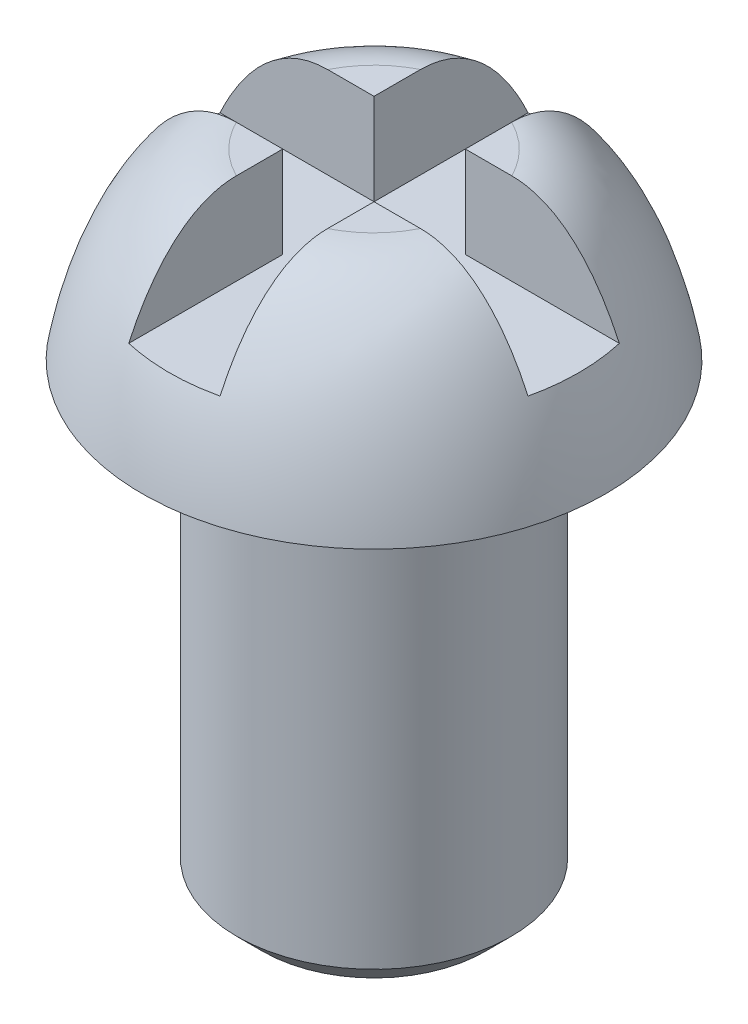
from build123d import *

# Parameters (mm, degrees)
SKETCH1_R           = 2.625
BOSS_EXTRUDE1_DEPTH = 2
SKETCH2_R           = 1.5
BOSS_EXTRUDE2_DEPTH = 5
FILLET1_SIZE        = 3
FILLET1_SIZE_2      = 1.5
SKETCH4_W           = 1
SKETCH4_H           = 1
CUT_EXTRUDE1_DEPTH  = 1


# Read off the part's stored shape, not the designer's step: M3x0.5 Machine Threads Stud1
with BuildPart() as part:
    # Sketch1 → Boss-Extrude1 (new body)
    with BuildSketch(Plane(origin=(0, 0, 0), x_dir=(1, 0, 0), z_dir=(0, 1, 0))):
        with Locations(Location((0, 0, 0), (0, 0, 270))):
            Circle(SKETCH1_R)
    extrude(amount=-BOSS_EXTRUDE1_DEPTH)

    # Sketch2 → Boss-Extrude2 (add)
    with BuildSketch(Plane(origin=(0, -2, 0), x_dir=(-1, 0, 0), z_dir=(0, -1, 0))):
        with Locations(Location((0, 0, 0), (0, 0, 90))):
            Circle(SKETCH2_R)
    extrude(amount=BOSS_EXTRUDE2_DEPTH)

    # M3x0.5 Machine Threads Stud1 outline → M3x0.5 Machine Threads Stud1 (revolve, cut)
    with BuildSketch(Plane.XY):
        Polygon((1.5, -6.7195), (1.2195, -7), (1.5, -7), align=None)
    revolve(axis=Axis((0, 0, 0), (0, 1, 0)), mode=Mode.SUBTRACT)

    # Fillet1
    # an asymmetric fillet: 3, 1.5 mm, written as the material it takes off along each edge
    with BuildSketch(Plane(origin=(0, 0, 0), x_dir=(0, 0, 1), z_dir=(-1, 0, 0))) as fillet1_piece_1:
        with BuildLine():
            Bezier((2.625, -FILLET1_SIZE), (2.625, 0), (2.625 - FILLET1_SIZE_2, 0), weights=[1, 0.707106781, 1])
            Line((2.625 - FILLET1_SIZE_2, 0), (2.625, 0))
            Line((2.625, 0), (2.625, -FILLET1_SIZE))
        make_face()
    revolve(axis=Axis((0, 0, 0), (0, 1, 0)), mode=Mode.SUBTRACT)

    # Sketch4 → Cut-Extrude1 (cut)
    with BuildSketch(Plane(origin=(0, 0, 0), x_dir=(-1, 0, 0), z_dir=(0, 1, 0))):
        with BuildLine():
            Line((-3, 0.5), (-3, -0.5))
            Line((-3, -0.5), (-1.007782219, -0.5))
            ThreePointArc((-1.007782219, -0.5), (-1.125, 0), (-1.007782219, 0.5))
            Line((-1.007782219, 0.5), (-3, 0.5))
        make_face()
        with BuildLine():
            ThreePointArc((-1.007782219, 0.5), (-1.125, 0), (-1.007782219, -0.5))
            Line((-1.007782219, -0.5), (-0.5, -0.5))
            Line((-0.5, -0.5), (-0.5, 0.5))
            Line((-0.5, 0.5), (-1.007782219, 0.5))
        make_face()
        Rectangle(SKETCH4_W, SKETCH4_H)
        with BuildLine():
            Line((0.5, -0.5), (-0.5, -0.5))
            Line((-0.5, -0.5), (-0.5, -1.007782219))
            ThreePointArc((-0.5, -1.007782219), (0, -1.125), (0.5, -1.007782219))
            Line((0.5, -1.007782219), (0.5, -0.5))
        make_face()
        with BuildLine():
            ThreePointArc((0.5, -1.007782219), (0, -1.125), (-0.5, -1.007782219))
            Line((-0.5, -1.007782219), (-0.5, -3))
            Line((-0.5, -3), (0.5, -3))
            Line((0.5, -3), (0.5, -1.007782219))
        make_face()
        with BuildLine():
            Line((0.5, 0.5), (0.5, -0.5))
            Line((0.5, -0.5), (1.007782219, -0.5))
            ThreePointArc((1.007782219, -0.5), (1.09530361, -0.256778118), (1.125, 0))
            ThreePointArc((1.125, 0), (1.09530361, 0.256778118), (1.007782219, 0.5))
            Line((1.007782219, 0.5), (0.5, 0.5))
        make_face()
        with BuildLine():
            ThreePointArc((1.125, 0), (1.09530361, -0.256778118), (1.007782219, -0.5))
            Line((1.007782219, -0.5), (3, -0.5))
            Line((3, -0.5), (3, 0.5))
            Line((3, 0.5), (1.007782219, 0.5))
            ThreePointArc((1.007782219, 0.5), (1.09530361, 0.256778118), (1.125, 0))
        make_face()
        with BuildLine():
            Line((-0.5, 1.007782219), (-0.5, 0.5))
            Line((-0.5, 0.5), (0.5, 0.5))
            Line((0.5, 0.5), (0.5, 1.007782219))
            ThreePointArc((0.5, 1.007782219), (0, 1.125), (-0.5, 1.007782219))
        make_face()
        with BuildLine():
            Line((-0.5, 3), (-0.5, 1.007782219))
            ThreePointArc((-0.5, 1.007782219), (0, 1.125), (0.5, 1.007782219))
            Line((0.5, 1.007782219), (0.5, 3))
            Line((0.5, 3), (-0.5, 3))
        make_face()
    extrude(amount=-CUT_EXTRUDE1_DEPTH, mode=Mode.SUBTRACT)


solid = part.part
